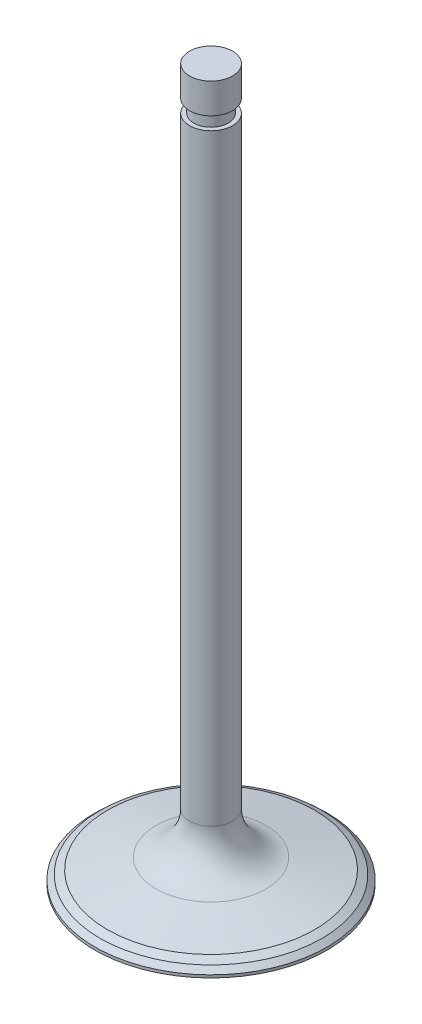
from build123d import *

# Parameters (mm, degrees)
FILLET1_R      = 10
CHAMFER1_SIZE  = 2
CHAMFER1_SIZE2 = 1.36299339
CHAMFER3_SIZE  = 1
CHAMFER3_SIZE2 = 0.999999525


with BuildPart() as part:
    # Sketch1 → Revolve1 (revolve)
    with BuildSketch(Plane.XY):
        Polygon((0, 0), (0, 165), (-5, 165), (-5, 158), (-4, 158), (-4, 155), (-5, 155), (-5, 7), (-27, 2), (-27, 0), align=None)
    revolve(axis=Axis((0, 0, 0), (0, 1, 0)))

    # Fillet1
    fillet1_edges = [part.edges().sort_by_distance(p)[0] for p in [
        (5, 7, 0),
    ]]
    fillet(fillet1_edges, radius=FILLET1_R)

    # Chamfer1
    chamfer1_edges = [part.edges().sort_by_distance(p)[0] for p in [
        (27, 2, 0),
    ]]
    chamfer1_side = [part.faces().sort_by_distance(p)[0] for p in [
        (19.891894482, 3.615478527, 0),
    ]]
    chamfer(chamfer1_edges, length=CHAMFER1_SIZE, length2=CHAMFER1_SIZE2, reference=chamfer1_side[0])

    # Chamfer3
    chamfer3_edges = [part.edges().sort_by_distance(p)[0] for p in [
        (25.049727894, 2.443242207, 0),
    ]]
    chamfer3_side = [part.faces().sort_by_distance(p)[0] for p in [
        (18.916761626, 3.83709963, 0),
    ]]
    chamfer(chamfer3_edges, length=CHAMFER3_SIZE, length2=CHAMFER3_SIZE2, reference=chamfer3_side[0])


solid = part.part
